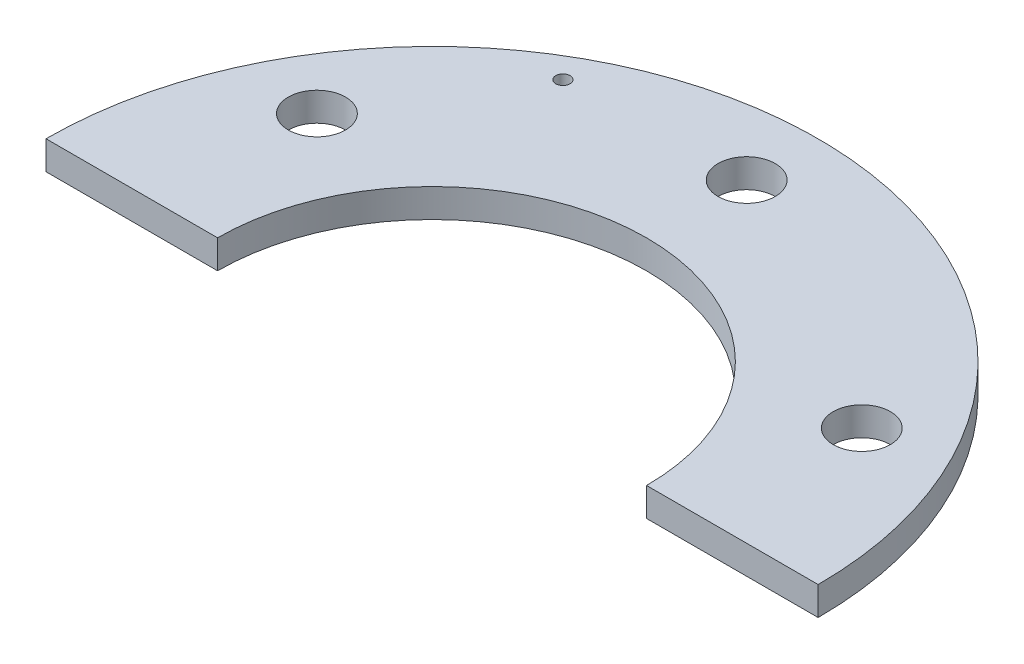
from build123d import *

# Parameters (mm, degrees)
SKETCH1_R               = 13.5
BOSS_EXTRUDE1_DEPTH     = 1
CUT_EXTRUDE1_DEPTH      = 20.118054294
CUT_EXTRUDE1_DEPTH_BACK = 20.118054294
SKETCH19_R              = 1
CUT_EXTRUDE2_DEPTH      = 20.118054294
CUT_EXTRUDE2_DEPTH_BACK = 20.118054294
SKETCH20_R              = 7.5
SKETCH21_W              = 65.874202484
SKETCH21_H              = 51.979273979
CUT_EXTRUDE3_DEPTH      = 20.118054294
CUT_EXTRUDE4_DEPTH      = 20.118054294
CUT_EXTRUDE4_DEPTH_BACK = 20.118054294
SKETCH22_R              = 0.25


with BuildPart() as part:
    # Sketch1 → Boss-Extrude1 (new body)
    with BuildSketch(Plane(origin=(0, 0, 0), x_dir=(1, 0, 0), z_dir=(0, 1, 0))):
        Circle(SKETCH1_R)
    extrude(amount=BOSS_EXTRUDE1_DEPTH)

    # Sketch19 → Cut-Extrude1 (cut, two sides: drawn at the far end of the back side and taken through both)
    with BuildSketch(Plane(origin=(0, 1, 0), x_dir=(1, 0, 0), z_dir=(0, 1, 0)).offset(-CUT_EXTRUDE1_DEPTH_BACK)):
        with Locations((0, 11)):
            Circle(SKETCH19_R)
        with Locations((9.526279442, 5.5)):
            Circle(SKETCH19_R)
        with Locations((9.526279442, -5.5)):
            Circle(SKETCH19_R)
        with Locations((0, -11)):
            Circle(SKETCH19_R)
        with Locations((-9.526279442, -5.5)):
            Circle(SKETCH19_R)
        with Locations((-9.526279442, 5.5)):
            Circle(SKETCH19_R)
    extrude(amount=CUT_EXTRUDE1_DEPTH + CUT_EXTRUDE1_DEPTH_BACK, mode=Mode.SUBTRACT)

    # Sketch20 → Cut-Extrude2 (cut, two sides: drawn at the far end of the back side and taken through both)
    with BuildSketch(Plane(origin=(0, 1, 0), x_dir=(1, 0, 0), z_dir=(0, 1, 0)).offset(-CUT_EXTRUDE2_DEPTH_BACK)):
        Circle(SKETCH20_R)
    extrude(amount=CUT_EXTRUDE2_DEPTH + CUT_EXTRUDE2_DEPTH_BACK, mode=Mode.SUBTRACT)

    # Sketch21 → Cut-Extrude3 (cut, through all)
    with BuildSketch(Plane.XY):
        with Locations((-3.816154381, 6.321647006)):
            Rectangle(SKETCH21_W, SKETCH21_H)
    extrude(amount=CUT_EXTRUDE3_DEPTH, mode=Mode.SUBTRACT)

    # Sketch22 → Cut-Extrude4 (cut, two sides: drawn at the far end of the back side and taken through both)
    with BuildSketch(Plane(origin=(0, 1, 0), x_dir=(1, 0, 0), z_dir=(0, 1, 0)).offset(-CUT_EXTRUDE4_DEPTH_BACK)):
        with Locations((-6.25, 10.825317547)):
            Circle(SKETCH22_R)
    extrude(amount=CUT_EXTRUDE4_DEPTH + CUT_EXTRUDE4_DEPTH_BACK, mode=Mode.SUBTRACT)


solid = part.part
